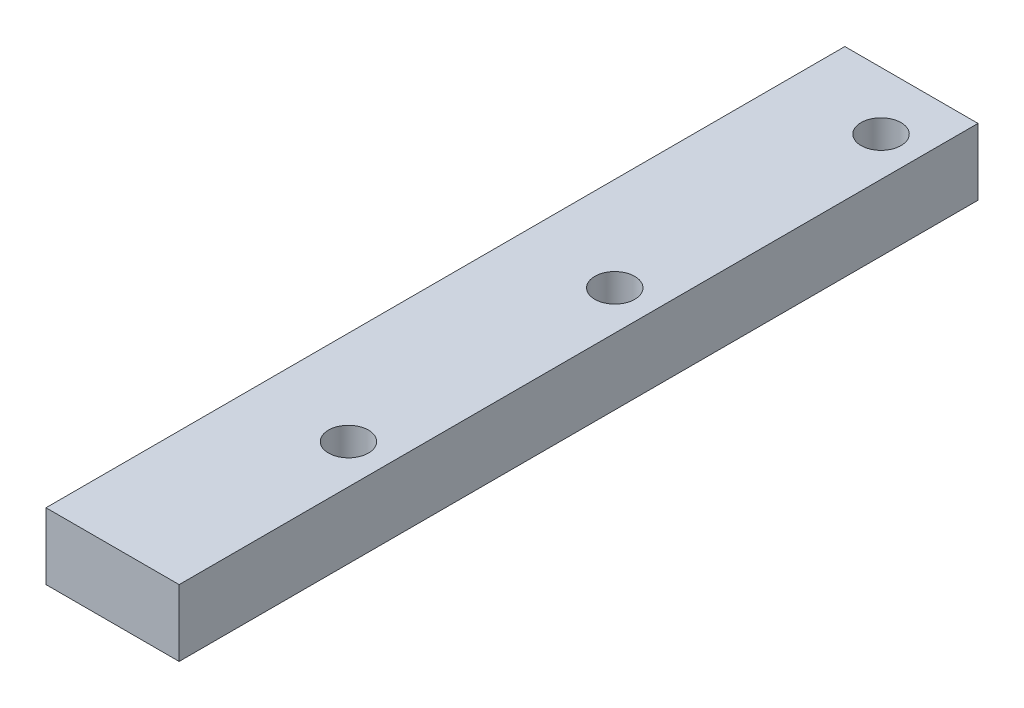
from build123d import *

# Parameters (mm, degrees)
SKETCH1_W           = 20
SKETCH1_H           = 10
BOSS_EXTRUDE1_DEPTH = 120
SKETCH2_R           = 3
CUT_EXTRUDE1_DEPTH  = 140
LPATTERN1_COUNT     = 4
LPATTERN1_PITCH     = 40


with BuildPart() as part:
    # Sketch1 → Boss-Extrude1 (new body)
    with BuildSketch(Plane.XY):
        with Locations((10, 15.187969925)):
            Rectangle(SKETCH1_W, SKETCH1_H)
    extrude(amount=BOSS_EXTRUDE1_DEPTH)

    # Sketch2 → Cut-Extrude1 (cut)
    with BuildSketch(Plane(origin=(0, 20.187969925, 0), x_dir=(1, 0, 0), z_dir=(0, 1, 0))):
        with Locations((14.108562183, -8.673667423)):
            Circle(SKETCH2_R)
    cut_extrude1 = extrude(amount=-CUT_EXTRUDE1_DEPTH, mode=Mode.SUBTRACT)

    # LPattern1: Cut-Extrude1 ×4
    with Locations(*[(0, 0, i * LPATTERN1_PITCH) for i in range(1, LPATTERN1_COUNT)]):
        add(cut_extrude1, mode=Mode.SUBTRACT)


solid = part.part
